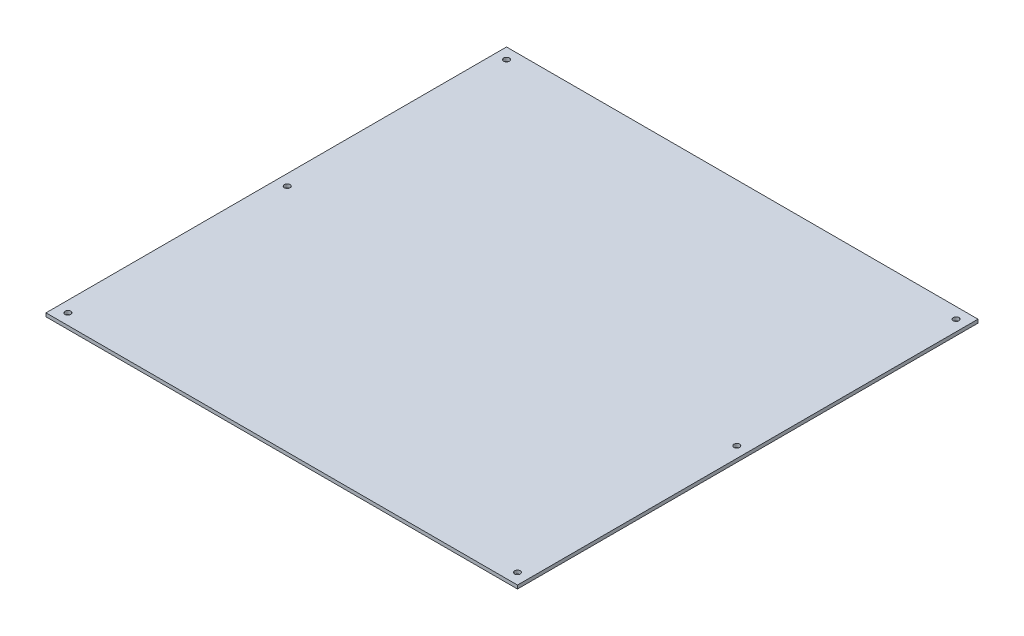
from build123d import *

# Parameters (mm, degrees)
SKETCH2_W           = 430
SKETCH2_H           = 420
SKETCH2_R           = 2.6
BOSS_EXTRUDE1_DEPTH = 1.5875


with BuildPart() as part:
    # Sketch2 → Boss-Extrude1 (new, symmetric)
    with BuildSketch(Plane(origin=(0, 0, 0), x_dir=(1, 0, 0), z_dir=(0, 1, 0))):
        Rectangle(SKETCH2_W, SKETCH2_H)
        with Locations((-205, 200)):
            Circle(SKETCH2_R, mode=Mode.SUBTRACT)
        with Locations((205, 200)):
            Circle(SKETCH2_R, mode=Mode.SUBTRACT)
        with Locations((205, -200)):
            Circle(SKETCH2_R, mode=Mode.SUBTRACT)
        with Locations((-205, -200)):
            Circle(SKETCH2_R, mode=Mode.SUBTRACT)
        with Locations((-205, 0)):
            Circle(SKETCH2_R, mode=Mode.SUBTRACT)
        with Locations((205, 0)):
            Circle(SKETCH2_R, mode=Mode.SUBTRACT)
    extrude(amount=BOSS_EXTRUDE1_DEPTH, both=True)


solid = part.part
